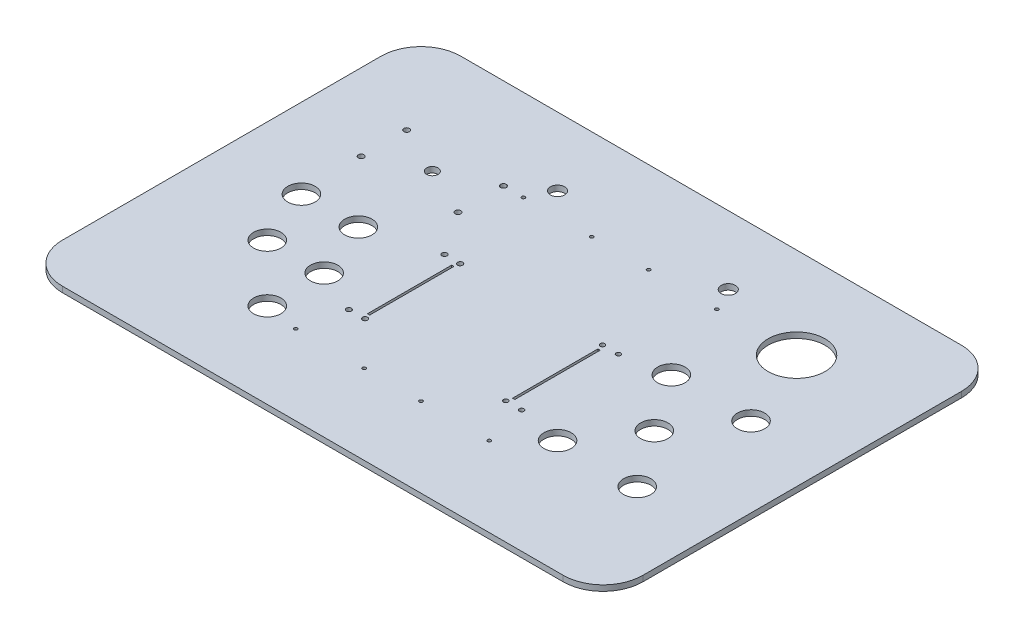
from build123d import *

# Parameters (mm, degrees)
SKETCH1_W               = 510
SKETCH1_H               = 350
BOSS_EXTRUDE1_DEPTH     = 5
SKETCH2_R               = 5
SKETCH2_R_2             = 2.5
F_1_JOYYSTICK_DEPTH     = 619.566892098
SKETCH3_R               = 12
F_1_BUTTONS_DEPTH       = 619.566892098
SKETCH4_R               = 6.25
F_1_ROCKET_SWITCH_DEPTH = 619.566892098
SKETCH5_R               = 2.25
SKETCH5_W               = 2
SKETCH5_H               = 74
F_1_POTENTIOMETER_DEPTH = 619.566892098
FILLET1_R               = 35
SKETCH6_R               = 12
F_2_BUTTONS_DEPTH       = 619.566892098
SKETCH9_R               = 25
F_2_SPEAKER_DEPTH       = 619.566892098
SKETCH10_R              = 6.25
F_2_ROCKET_SWITCH_DEPTH = 619.566892098
SKETCH8_R               = 2
SKETCH8_W               = 2
SKETCH8_H               = 75
F_2_POTENTIOMETER_DEPTH = 619.566892098
SKETCH11_R              = 1.5
F_2_PCB1_DEPTH          = 619.566892098
SKETCH12_R              = 1.5
F_1_PCB2_DEPTH          = 619.566892098


with BuildPart() as part:
    # Sketch1 → Boss-Extrude1 (new body)
    with BuildSketch(Plane(origin=(0, 0, 0), x_dir=(1, 0, 0), z_dir=(0, 1, 0))):
        with Locations((255, 175)):
            Rectangle(SKETCH1_W, SKETCH1_H)
    extrude(amount=BOSS_EXTRUDE1_DEPTH)

    # Sketch2 → 1 Joyystick (cut, through all)
    with BuildSketch(Plane(origin=(0, 5, 0), x_dir=(1, 0, 0), z_dir=(0, 1, 0))):
        with Locations((110, 250)):
            Circle(SKETCH2_R)
        with Locations((152.5, 270)):
            Circle(SKETCH2_R_2)
        with Locations((152.5, 230)):
            Circle(SKETCH2_R_2)
        with Locations((67.5, 230)):
            Circle(SKETCH2_R_2)
        with Locations((67.5, 270)):
            Circle(SKETCH2_R_2)
    extrude(amount=-F_1_JOYYSTICK_DEPTH, mode=Mode.SUBTRACT)

    # Sketch3 → 1 Buttons (cut, through all)
    with BuildSketch(Plane(origin=(0, 5, 0), x_dir=(1, 0, 0), z_dir=(0, 1, 0))):
        with Locations((70, 175)):
            Circle(SKETCH3_R)
        with Locations((120, 175)):
            Circle(SKETCH3_R)
        with Locations((90, 125)):
            Circle(SKETCH3_R)
        with Locations((140, 125)):
            Circle(SKETCH3_R)
        with Locations((140, 75)):
            Circle(SKETCH3_R)
    extrude(amount=-F_1_BUTTONS_DEPTH, mode=Mode.SUBTRACT)

    # Sketch4 → 1 Rocket Switch (cut, through all)
    with BuildSketch(Plane(origin=(0, 5, 0), x_dir=(1, 0, 0), z_dir=(0, 1, 0))):
        with Locations((180, 290)):
            Circle(SKETCH4_R)
    extrude(amount=-F_1_ROCKET_SWITCH_DEPTH, mode=Mode.SUBTRACT)

    # Sketch5 → 1 Potentiometer (cut, through all)
    with BuildSketch(Plane(origin=(0, 5, 0), x_dir=(1, 0, 0), z_dir=(0, 1, 0))):
        with Locations((178.719749064, 192)):
            Circle(SKETCH5_R)
        with Locations((192.718338039, 191.801237073)):
            Circle(SKETCH5_R)
        with Locations((192.718338039, 108.198762927)):
            Circle(SKETCH5_R)
        with Locations((178.719749064, 108)):
            Circle(SKETCH5_R)
        with Locations((191, 150)):
            Rectangle(SKETCH5_W, SKETCH5_H)
    extrude(amount=-F_1_POTENTIOMETER_DEPTH, mode=Mode.SUBTRACT)

    # Fillet1
    fillet1_edges = [part.edges().sort_by_distance(p)[0] for p in [
        (0, 2.5, 0),
        (510, 2.5, 0),
        (510, 2.5, -350),
        (0, 2.5, -350),
    ]]
    fillet(fillet1_edges, radius=FILLET1_R)

    # Sketch6 → 2 Buttons (cut, through all)
    with BuildSketch(Plane(origin=(0, 5, 0), x_dir=(1, 0, 0), z_dir=(0, 1, 0))):
        with Locations((440, 200)):
            Circle(SKETCH6_R)
        with Locations((370, 200)):
            Circle(SKETCH6_R)
        with Locations((440, 100)):
            Circle(SKETCH6_R)
        with Locations((370, 100)):
            Circle(SKETCH6_R)
        with Locations((405, 150)):
            Circle(SKETCH6_R)
    extrude(amount=-F_2_BUTTONS_DEPTH, mode=Mode.SUBTRACT)

    # Sketch9 → 2 speaker (cut, through all)
    with BuildSketch(Plane(origin=(0, 5, 0), x_dir=(1, 0, 0), z_dir=(0, 1, 0))):
        with Locations((410, 270)):
            Circle(SKETCH9_R)
    extrude(amount=-F_2_SPEAKER_DEPTH, mode=Mode.SUBTRACT)

    # Sketch10 → 2 Rocket Switch (cut, through all)
    with BuildSketch(Plane(origin=(0, 5, 0), x_dir=(1, 0, 0), z_dir=(0, 1, 0))):
        with Locations((330, 290)):
            Circle(SKETCH10_R)
    extrude(amount=-F_2_ROCKET_SWITCH_DEPTH, mode=Mode.SUBTRACT)

    # Sketch8 → 2 Potentiometer (cut, through all)
    with BuildSketch(Plane(origin=(0, 5, 0), x_dir=(1, 0, 0), z_dir=(0, 1, 0))):
        with Locations((331, 192.5)):
            Circle(SKETCH8_R)
        with Locations((331, 107.5)):
            Circle(SKETCH8_R)
        with Locations((317, 107.5)):
            Circle(SKETCH8_R)
        with Locations((317, 192.5)):
            Circle(SKETCH8_R)
        with Locations((319, 150)):
            Rectangle(SKETCH8_W, SKETCH8_H)
    extrude(amount=-F_2_POTENTIOMETER_DEPTH, mode=Mode.SUBTRACT)

    # Sketch11 → 2 PCB1 (cut, through all)
    with BuildSketch(Plane(origin=(0, 5, 0), x_dir=(1, 0, 0), z_dir=(0, 1, 0))):
        with Locations((340, 70)):
            Circle(SKETCH11_R)
        with Locations((280, 70)):
            Circle(SKETCH11_R)
        with Locations((280, 270)):
            Circle(SKETCH11_R)
        with Locations((340, 270)):
            Circle(SKETCH11_R)
    extrude(amount=-F_2_PCB1_DEPTH, mode=Mode.SUBTRACT)

    # Sketch12 → 1 PCB2 (cut, through all)
    with BuildSketch(Plane(origin=(0, 5, 0), x_dir=(1, 0, 0), z_dir=(0, 1, 0))):
        with Locations((230, 70)):
            Circle(SKETCH12_R)
        with Locations((170, 70)):
            Circle(SKETCH12_R)
        with Locations((230, 270)):
            Circle(SKETCH12_R)
        with Locations((170, 270)):
            Circle(SKETCH12_R)
    extrude(amount=-F_1_PCB2_DEPTH, mode=Mode.SUBTRACT)


solid = part.part
